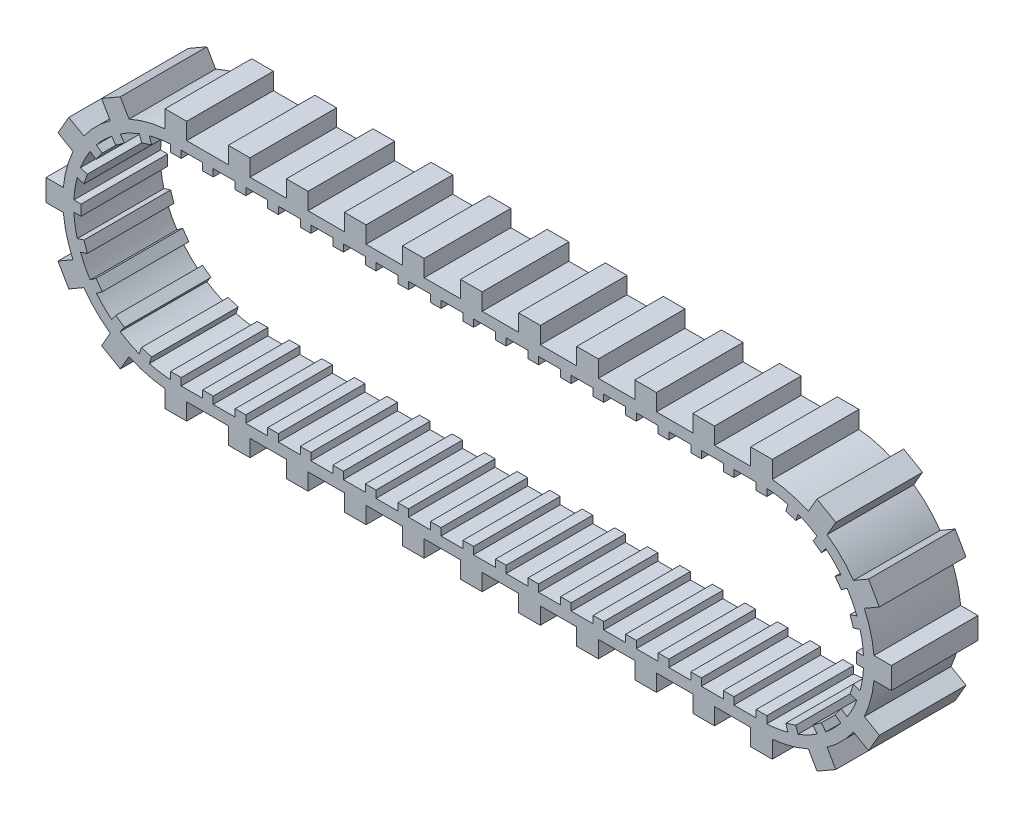
from build123d import *

# Parameters (mm, degrees)
BOSS_EXTRUDE1_DEPTH      = 25.4
BOSS_EXTRUDE2_DEPTH      = 25.4
CIRPATTERN1_COUNT        = 11
CIRPATTERN1_ANGLE        = 180
MIRROR2_COPY_1_DEPTH     = 25.4
MIRROR2_COPY_2_DEPTH     = 25.4
MIRROR2_COPY_3_DEPTH     = 25.4
MIRROR2_COPY_4_DEPTH     = 25.4
MIRROR2_COPY_5_DEPTH     = 25.4
MIRROR2_COPY_6_DEPTH     = 25.4
MIRROR2_COPY_7_DEPTH     = 25.4
MIRROR2_COPY_8_DEPTH     = 25.4
MIRROR2_COPY_9_DEPTH     = 25.4
MIRROR2_COPY_10_DEPTH    = 25.4
SKETCH5_W                = 3.10134
SKETCH5_H                = 2.1336
BOSS_EXTRUDE3_DEPTH      = 25.4
LPATTERN1_COUNT          = 17
LPATTERN1_PITCH          = 9.5377
MIRROR3_COPY_1_SKETCH_W  = 3.10134
MIRROR3_COPY_1_SKETCH_H  = 2.1336
MIRROR3_COPY_1_DEPTH     = 25.4
MIRROR3_COPY_2_SKETCH_W  = 3.10134
MIRROR3_COPY_2_SKETCH_H  = 2.1336
MIRROR3_COPY_2_DEPTH     = 25.4
MIRROR3_COPY_3_SKETCH_W  = 3.10134
MIRROR3_COPY_3_SKETCH_H  = 2.1336
MIRROR3_COPY_3_DEPTH     = 25.4
MIRROR3_COPY_4_SKETCH_W  = 3.10134
MIRROR3_COPY_4_SKETCH_H  = 2.1336
MIRROR3_COPY_4_DEPTH     = 25.4
MIRROR3_COPY_5_SKETCH_W  = 3.10134
MIRROR3_COPY_5_SKETCH_H  = 2.1336
MIRROR3_COPY_5_DEPTH     = 25.4
MIRROR3_COPY_6_SKETCH_W  = 3.10134
MIRROR3_COPY_6_SKETCH_H  = 2.1336
MIRROR3_COPY_6_DEPTH     = 25.4
MIRROR3_COPY_7_SKETCH_W  = 3.10134
MIRROR3_COPY_7_SKETCH_H  = 2.1336
MIRROR3_COPY_7_DEPTH     = 25.4
MIRROR3_COPY_8_SKETCH_W  = 3.10134
MIRROR3_COPY_8_SKETCH_H  = 2.1336
MIRROR3_COPY_8_DEPTH     = 25.4
MIRROR3_COPY_9_SKETCH_W  = 3.10134
MIRROR3_COPY_9_SKETCH_H  = 2.1336
MIRROR3_COPY_9_DEPTH     = 25.4
MIRROR3_COPY_10_SKETCH_W = 3.10134
MIRROR3_COPY_10_SKETCH_H = 2.1336
MIRROR3_COPY_10_DEPTH    = 25.4
MIRROR3_COPY_11_SKETCH_W = 3.10134
MIRROR3_COPY_11_SKETCH_H = 2.1336
MIRROR3_COPY_11_DEPTH    = 25.4
MIRROR3_COPY_12_SKETCH_W = 3.10134
MIRROR3_COPY_12_SKETCH_H = 2.1336
MIRROR3_COPY_12_DEPTH    = 25.4
MIRROR3_COPY_13_SKETCH_W = 3.10134
MIRROR3_COPY_13_SKETCH_H = 2.1336
MIRROR3_COPY_13_DEPTH    = 25.4
MIRROR3_COPY_14_SKETCH_W = 3.10134
MIRROR3_COPY_14_SKETCH_H = 2.1336
MIRROR3_COPY_14_DEPTH    = 25.4
MIRROR3_COPY_15_SKETCH_W = 3.10134
MIRROR3_COPY_15_SKETCH_H = 2.1336
MIRROR3_COPY_15_DEPTH    = 25.4
MIRROR3_COPY_16_SKETCH_W = 3.10134
MIRROR3_COPY_16_SKETCH_H = 2.1336
MIRROR3_COPY_16_DEPTH    = 25.4
SKETCH6_W                = 6.35
SKETCH6_H                = 5.08
BOSS_EXTRUDE4_DEPTH      = 25.4
CIRPATTERN2_COUNT        = 7
CIRPATTERN2_ANGLE        = 180
MIRROR4_COPY_1_SKETCH_W  = 6.35
MIRROR4_COPY_1_SKETCH_H  = 5.08
MIRROR4_COPY_1_DEPTH     = 25.4
MIRROR4_COPY_2_SKETCH_W  = 6.35
MIRROR4_COPY_2_SKETCH_H  = 5.08
MIRROR4_COPY_2_DEPTH     = 25.4
MIRROR4_COPY_3_SKETCH_W  = 6.35
MIRROR4_COPY_3_SKETCH_H  = 5.08
MIRROR4_COPY_3_DEPTH     = 25.4
MIRROR4_COPY_4_SKETCH_W  = 6.35
MIRROR4_COPY_4_SKETCH_H  = 5.08
MIRROR4_COPY_4_DEPTH     = 25.4
MIRROR4_COPY_5_SKETCH_W  = 6.35
MIRROR4_COPY_5_SKETCH_H  = 5.08
MIRROR4_COPY_5_DEPTH     = 25.4
MIRROR4_COPY_6_SKETCH_W  = 6.35
MIRROR4_COPY_6_SKETCH_H  = 5.08
MIRROR4_COPY_6_DEPTH     = 25.4
SKETCH10_W               = 6.35
SKETCH10_H               = 4.927531536
BOSS_EXTRUDE5_DEPTH      = 25.4
LPATTERN2_COUNT          = 9
LPATTERN2_PITCH          = 17.018
MIRROR5_COPY_1_SKETCH_W  = 6.35
MIRROR5_COPY_1_SKETCH_H  = 4.927531536
MIRROR5_COPY_1_DEPTH     = 25.4
MIRROR5_COPY_2_SKETCH_W  = 6.35
MIRROR5_COPY_2_SKETCH_H  = 4.927531536
MIRROR5_COPY_2_DEPTH     = 25.4
MIRROR5_COPY_3_SKETCH_W  = 6.35
MIRROR5_COPY_3_SKETCH_H  = 4.927531536
MIRROR5_COPY_3_DEPTH     = 25.4
MIRROR5_COPY_4_SKETCH_W  = 6.35
MIRROR5_COPY_4_SKETCH_H  = 4.927531536
MIRROR5_COPY_4_DEPTH     = 25.4
MIRROR5_COPY_5_SKETCH_W  = 6.35
MIRROR5_COPY_5_SKETCH_H  = 4.927531536
MIRROR5_COPY_5_DEPTH     = 25.4
MIRROR5_COPY_6_SKETCH_W  = 6.35
MIRROR5_COPY_6_SKETCH_H  = 4.927531536
MIRROR5_COPY_6_DEPTH     = 25.4
MIRROR5_COPY_7_SKETCH_W  = 6.35
MIRROR5_COPY_7_SKETCH_H  = 4.927531536
MIRROR5_COPY_7_DEPTH     = 25.4
MIRROR5_COPY_8_SKETCH_W  = 6.35
MIRROR5_COPY_8_SKETCH_H  = 4.927531536
MIRROR5_COPY_8_DEPTH     = 25.4


with BuildPart() as part:
    # Sketch1 → Boss-Extrude1 (new body)
    with BuildSketch(Plane.XY):
        with BuildLine():
            Line((0, 33.1343), (171.632290117, 33.1343))
            ThreePointArc((171.632290117, 33.1343), (204.766590117, 0), (171.632290117, -33.1343))
            Line((171.632290117, -33.1343), (0, -33.1343))
            ThreePointArc((0, -33.1343), (-33.1343, 0), (0, 33.1343))
        make_face()
        with BuildLine():
            Line((0, 29.9339), (171.632290117, 29.9339))
            ThreePointArc((171.632290117, 29.9339), (201.566190117, 0), (171.632290117, -29.9339))
            Line((171.632290117, -29.9339), (0, -29.9339))
            ThreePointArc((0, -29.9339), (-29.9339, 0), (0, 29.9339))
        make_face(mode=Mode.SUBTRACT)
    extrude(amount=-BOSS_EXTRUDE1_DEPTH)

    # Sketch3 → Boss-Extrude2 (add)
    with BuildSketch(Plane.XY):
        Polygon((-1.55067, 27.8003), (1.55067, 27.8003), (1.55067, 30.101580881), (-1.55067, 30.401027434), align=None)
    boss_extrude2 = extrude(amount=-BOSS_EXTRUDE2_DEPTH)

    # CirPattern1: Boss-Extrude2 ×11 about axis
    cirpattern1_axis = Axis((0, 0, 0), (0, 0, 1))
    for i in range(1, CIRPATTERN1_COUNT):
        add(boss_extrude2.rotate(cirpattern1_axis, i * CIRPATTERN1_ANGLE / (CIRPATTERN1_COUNT - 1)))

    # Mirror2: Boss-Extrude2 across plane
    add(boss_extrude2.mirror(Plane(origin=(85.816145059, 0, 0), x_dir=(0, 0, 1), z_dir=(1, 0, 0))))

    # Mirror2 copy 1 sketch → Mirror2 copy 1 (add)
    with BuildSketch(Plane(origin=(171.632290117, 0, 0), x_dir=(-0.9510565162951534, 0.30901699437494806, 0), z_dir=(0, 0, 1))):
        Polygon((-1.55067, -27.8003), (1.55067, -27.8003), (1.55067, -30.101580881), (-1.55067, -30.401027434), align=None)
    extrude(amount=-MIRROR2_COPY_1_DEPTH)

    # Mirror2 copy 2 sketch → Mirror2 copy 2 (add)
    with BuildSketch(Plane(origin=(171.632290117, 0, 0), x_dir=(-0.8090169943749467, 0.5877852522924741, 0), z_dir=(0, 0, 1))):
        Polygon((-1.55067, -27.8003), (1.55067, -27.8003), (1.55067, -30.101580881), (-1.55067, -30.401027434), align=None)
    extrude(amount=-MIRROR2_COPY_2_DEPTH)

    # Mirror2 copy 3 sketch → Mirror2 copy 3 (add)
    with BuildSketch(Plane(origin=(171.632290117, 0, 0), x_dir=(-0.5877852522924716, 0.8090169943749486, 0), z_dir=(0, 0, 1))):
        Polygon((-1.55067, -27.8003), (1.55067, -27.8003), (1.55067, -30.101580881), (-1.55067, -30.401027434), align=None)
    extrude(amount=-MIRROR2_COPY_3_DEPTH)

    # Mirror2 copy 4 sketch → Mirror2 copy 4 (add)
    with BuildSketch(Plane(origin=(171.632290117, 0, 0), x_dir=(-0.30901699437494495, 0.9510565162951544, 0), z_dir=(0, 0, 1))):
        Polygon((-1.55067, -27.8003), (1.55067, -27.8003), (1.55067, -30.101580881), (-1.55067, -30.401027434), align=None)
    extrude(amount=-MIRROR2_COPY_4_DEPTH)

    # Mirror2 copy 5 sketch → Mirror2 copy 5 (add)
    with BuildSketch(Plane(origin=(171.632290117, 0, 0), x_dir=(0, 1, 0), z_dir=(0, 0, 1))):
        Polygon((-1.55067, -27.8003), (1.55067, -27.8003), (1.55067, -30.101580881), (-1.55067, -30.401027434), align=None)
    extrude(amount=-MIRROR2_COPY_5_DEPTH)

    # Mirror2 copy 6 sketch → Mirror2 copy 6 (add)
    with BuildSketch(Plane(origin=(171.632290117, 0, 0), x_dir=(0.30901699437495117, 0.9510565162951523, 0), z_dir=(0, 0, 1))):
        Polygon((-1.55067, -27.8003), (1.55067, -27.8003), (1.55067, -30.101580881), (-1.55067, -30.401027434), align=None)
    extrude(amount=-MIRROR2_COPY_6_DEPTH)

    # Mirror2 copy 7 sketch → Mirror2 copy 7 (add)
    with BuildSketch(Plane(origin=(171.632290117, 0, 0), x_dir=(0.587785252292477, 0.8090169943749446, 0), z_dir=(0, 0, 1))):
        Polygon((-1.55067, -27.8003), (1.55067, -27.8003), (1.55067, -30.101580881), (-1.55067, -30.401027434), align=None)
    extrude(amount=-MIRROR2_COPY_7_DEPTH)

    # Mirror2 copy 8 sketch → Mirror2 copy 8 (add)
    with BuildSketch(Plane(origin=(171.632290117, 0, 0), x_dir=(0.8090169943749504, 0.5877852522924689, 0), z_dir=(0, 0, 1))):
        Polygon((-1.55067, -27.8003), (1.55067, -27.8003), (1.55067, -30.101580881), (-1.55067, -30.401027434), align=None)
    extrude(amount=-MIRROR2_COPY_8_DEPTH)

    # Mirror2 copy 9 sketch → Mirror2 copy 9 (add)
    with BuildSketch(Plane(origin=(171.632290117, 0, 0), x_dir=(0.9510565162951554, 0.3090169943749416, 0), z_dir=(0, 0, 1))):
        Polygon((-1.55067, -27.8003), (1.55067, -27.8003), (1.55067, -30.101580881), (-1.55067, -30.401027434), align=None)
    extrude(amount=-MIRROR2_COPY_9_DEPTH)

    # Mirror2 copy 10 sketch → Mirror2 copy 10 (add)
    with BuildSketch(Plane(origin=(171.632290117, 0, 0), x_dir=(1, 0, 0), z_dir=(0, 0, 1))):
        Polygon((-1.55067, -27.8003), (1.55067, -27.8003), (1.55067, -30.101580881), (-1.55067, -30.401027434), align=None)
    extrude(amount=-MIRROR2_COPY_10_DEPTH)

    # Sketch5 → Boss-Extrude3 (add)
    with BuildSketch(Plane.XY):
        with Locations((9.40054, 28.8671)):
            Rectangle(SKETCH5_W, SKETCH5_H)
    boss_extrude3 = extrude(amount=-BOSS_EXTRUDE3_DEPTH)

    # LPattern1: Boss-Extrude3 ×17
    with Locations(*[(i * LPATTERN1_PITCH, 0, 0) for i in range(1, LPATTERN1_COUNT)]):
        add(boss_extrude3)

    # Mirror3: Boss-Extrude3 across plane
    add(boss_extrude3.mirror(Plane.ZX))

    # Mirror3 copy 1 sketch → Mirror3 copy 1 (add)
    with BuildSketch(Plane(origin=(9.5377, 0, 0), x_dir=(1, 0, 0), z_dir=(0, 0, 1))):
        with Locations((9.40054, -28.8671)):
            Rectangle(MIRROR3_COPY_1_SKETCH_W, MIRROR3_COPY_1_SKETCH_H)
    extrude(amount=-MIRROR3_COPY_1_DEPTH)

    # Mirror3 copy 2 sketch → Mirror3 copy 2 (add)
    with BuildSketch(Plane(origin=(19.0754, 0, 0), x_dir=(1, 0, 0), z_dir=(0, 0, 1))):
        with Locations((9.40054, -28.8671)):
            Rectangle(MIRROR3_COPY_2_SKETCH_W, MIRROR3_COPY_2_SKETCH_H)
    extrude(amount=-MIRROR3_COPY_2_DEPTH)

    # Mirror3 copy 3 sketch → Mirror3 copy 3 (add)
    with BuildSketch(Plane(origin=(28.6131, 0, 0), x_dir=(1, 0, 0), z_dir=(0, 0, 1))):
        with Locations((9.40054, -28.8671)):
            Rectangle(MIRROR3_COPY_3_SKETCH_W, MIRROR3_COPY_3_SKETCH_H)
    extrude(amount=-MIRROR3_COPY_3_DEPTH)

    # Mirror3 copy 4 sketch → Mirror3 copy 4 (add)
    with BuildSketch(Plane(origin=(38.1508, 0, 0), x_dir=(1, 0, 0), z_dir=(0, 0, 1))):
        with Locations((9.40054, -28.8671)):
            Rectangle(MIRROR3_COPY_4_SKETCH_W, MIRROR3_COPY_4_SKETCH_H)
    extrude(amount=-MIRROR3_COPY_4_DEPTH)

    # Mirror3 copy 5 sketch → Mirror3 copy 5 (add)
    with BuildSketch(Plane(origin=(47.6885, 0, 0), x_dir=(1, 0, 0), z_dir=(0, 0, 1))):
        with Locations((9.40054, -28.8671)):
            Rectangle(MIRROR3_COPY_5_SKETCH_W, MIRROR3_COPY_5_SKETCH_H)
    extrude(amount=-MIRROR3_COPY_5_DEPTH)

    # Mirror3 copy 6 sketch → Mirror3 copy 6 (add)
    with BuildSketch(Plane(origin=(57.2262, 0, 0), x_dir=(1, 0, 0), z_dir=(0, 0, 1))):
        with Locations((9.40054, -28.8671)):
            Rectangle(MIRROR3_COPY_6_SKETCH_W, MIRROR3_COPY_6_SKETCH_H)
    extrude(amount=-MIRROR3_COPY_6_DEPTH)

    # Mirror3 copy 7 sketch → Mirror3 copy 7 (add)
    with BuildSketch(Plane(origin=(66.7639, 0, 0), x_dir=(1, 0, 0), z_dir=(0, 0, 1))):
        with Locations((9.40054, -28.8671)):
            Rectangle(MIRROR3_COPY_7_SKETCH_W, MIRROR3_COPY_7_SKETCH_H)
    extrude(amount=-MIRROR3_COPY_7_DEPTH)

    # Mirror3 copy 8 sketch → Mirror3 copy 8 (add)
    with BuildSketch(Plane(origin=(76.3016, 0, 0), x_dir=(1, 0, 0), z_dir=(0, 0, 1))):
        with Locations((9.40054, -28.8671)):
            Rectangle(MIRROR3_COPY_8_SKETCH_W, MIRROR3_COPY_8_SKETCH_H)
    extrude(amount=-MIRROR3_COPY_8_DEPTH)

    # Mirror3 copy 9 sketch → Mirror3 copy 9 (add)
    with BuildSketch(Plane(origin=(85.8393, 0, 0), x_dir=(1, 0, 0), z_dir=(0, 0, 1))):
        with Locations((9.40054, -28.8671)):
            Rectangle(MIRROR3_COPY_9_SKETCH_W, MIRROR3_COPY_9_SKETCH_H)
    extrude(amount=-MIRROR3_COPY_9_DEPTH)

    # Mirror3 copy 10 sketch → Mirror3 copy 10 (add)
    with BuildSketch(Plane(origin=(95.377, 0, 0), x_dir=(1, 0, 0), z_dir=(0, 0, 1))):
        with Locations((9.40054, -28.8671)):
            Rectangle(MIRROR3_COPY_10_SKETCH_W, MIRROR3_COPY_10_SKETCH_H)
    extrude(amount=-MIRROR3_COPY_10_DEPTH)

    # Mirror3 copy 11 sketch → Mirror3 copy 11 (add)
    with BuildSketch(Plane(origin=(104.9147, 0, 0), x_dir=(1, 0, 0), z_dir=(0, 0, 1))):
        with Locations((9.40054, -28.8671)):
            Rectangle(MIRROR3_COPY_11_SKETCH_W, MIRROR3_COPY_11_SKETCH_H)
    extrude(amount=-MIRROR3_COPY_11_DEPTH)

    # Mirror3 copy 12 sketch → Mirror3 copy 12 (add)
    with BuildSketch(Plane(origin=(114.4524, 0, 0), x_dir=(1, 0, 0), z_dir=(0, 0, 1))):
        with Locations((9.40054, -28.8671)):
            Rectangle(MIRROR3_COPY_12_SKETCH_W, MIRROR3_COPY_12_SKETCH_H)
    extrude(amount=-MIRROR3_COPY_12_DEPTH)

    # Mirror3 copy 13 sketch → Mirror3 copy 13 (add)
    with BuildSketch(Plane(origin=(123.9901, 0, 0), x_dir=(1, 0, 0), z_dir=(0, 0, 1))):
        with Locations((9.40054, -28.8671)):
            Rectangle(MIRROR3_COPY_13_SKETCH_W, MIRROR3_COPY_13_SKETCH_H)
    extrude(amount=-MIRROR3_COPY_13_DEPTH)

    # Mirror3 copy 14 sketch → Mirror3 copy 14 (add)
    with BuildSketch(Plane(origin=(133.5278, 0, 0), x_dir=(1, 0, 0), z_dir=(0, 0, 1))):
        with Locations((9.40054, -28.8671)):
            Rectangle(MIRROR3_COPY_14_SKETCH_W, MIRROR3_COPY_14_SKETCH_H)
    extrude(amount=-MIRROR3_COPY_14_DEPTH)

    # Mirror3 copy 15 sketch → Mirror3 copy 15 (add)
    with BuildSketch(Plane(origin=(143.0655, 0, 0), x_dir=(1, 0, 0), z_dir=(0, 0, 1))):
        with Locations((9.40054, -28.8671)):
            Rectangle(MIRROR3_COPY_15_SKETCH_W, MIRROR3_COPY_15_SKETCH_H)
    extrude(amount=-MIRROR3_COPY_15_DEPTH)

    # Mirror3 copy 16 sketch → Mirror3 copy 16 (add)
    with BuildSketch(Plane(origin=(152.6032, 0, 0), x_dir=(1, 0, 0), z_dir=(0, 0, 1))):
        with Locations((9.40054, -28.8671)):
            Rectangle(MIRROR3_COPY_16_SKETCH_W, MIRROR3_COPY_16_SKETCH_H)
    extrude(amount=-MIRROR3_COPY_16_DEPTH)

    # Sketch6 → Boss-Extrude4 (add)
    with BuildSketch(Plane.XY):
        with Locations((0, 35.521831536)):
            Rectangle(SKETCH6_W, SKETCH6_H)
    boss_extrude4 = extrude(amount=-BOSS_EXTRUDE4_DEPTH)

    # CirPattern2: Boss-Extrude4 ×7 about axis
    cirpattern2_axis = Axis((0, 0, 0), (0, 0, 1))
    for i in range(1, CIRPATTERN2_COUNT):
        add(boss_extrude4.rotate(cirpattern2_axis, i * CIRPATTERN2_ANGLE / (CIRPATTERN2_COUNT - 1)))

    # Mirror4: Boss-Extrude4 across plane
    add(boss_extrude4.mirror(Plane(origin=(85.816145059, 0, 0), x_dir=(0, 0, 1), z_dir=(1, 0, 0))))

    # Mirror4 copy 1 sketch → Mirror4 copy 1 (add)
    with BuildSketch(Plane(origin=(171.632290117, 0, 0), x_dir=(-0.866025403784438, 0.500000000000001, 0), z_dir=(0, 0, 1))):
        with Locations((0, -35.521831536)):
            Rectangle(MIRROR4_COPY_1_SKETCH_W, MIRROR4_COPY_1_SKETCH_H)
    extrude(amount=-MIRROR4_COPY_1_DEPTH)

    # Mirror4 copy 2 sketch → Mirror4 copy 2 (add)
    with BuildSketch(Plane(origin=(171.632290117, 0, 0), x_dir=(-0.499999999999998, 0.8660254037844398, 0), z_dir=(0, 0, 1))):
        with Locations((0, -35.521831536)):
            Rectangle(MIRROR4_COPY_2_SKETCH_W, MIRROR4_COPY_2_SKETCH_H)
    extrude(amount=-MIRROR4_COPY_2_DEPTH)

    # Mirror4 copy 3 sketch → Mirror4 copy 3 (add)
    with BuildSketch(Plane(origin=(171.632290117, 0, 0), x_dir=(0, 1, 0), z_dir=(0, 0, 1))):
        with Locations((0, -35.521831536)):
            Rectangle(MIRROR4_COPY_3_SKETCH_W, MIRROR4_COPY_3_SKETCH_H)
    extrude(amount=-MIRROR4_COPY_3_DEPTH)

    # Mirror4 copy 4 sketch → Mirror4 copy 4 (add)
    with BuildSketch(Plane(origin=(171.632290117, 0, 0), x_dir=(0.500000000000004, 0.8660254037844363, 0), z_dir=(0, 0, 1))):
        with Locations((0, -35.521831536)):
            Rectangle(MIRROR4_COPY_4_SKETCH_W, MIRROR4_COPY_4_SKETCH_H)
    extrude(amount=-MIRROR4_COPY_4_DEPTH)

    # Mirror4 copy 5 sketch → Mirror4 copy 5 (add)
    with BuildSketch(Plane(origin=(171.632290117, 0, 0), x_dir=(0.8660254037844416, 0.49999999999999495, 0), z_dir=(0, 0, 1))):
        with Locations((0, -35.521831536)):
            Rectangle(MIRROR4_COPY_5_SKETCH_W, MIRROR4_COPY_5_SKETCH_H)
    extrude(amount=-MIRROR4_COPY_5_DEPTH)

    # Mirror4 copy 6 sketch → Mirror4 copy 6 (add)
    with BuildSketch(Plane(origin=(171.632290117, 0, 0), x_dir=(1, 0, 0), z_dir=(0, 0, 1))):
        with Locations((0, -35.521831536)):
            Rectangle(MIRROR4_COPY_6_SKETCH_W, MIRROR4_COPY_6_SKETCH_H)
    extrude(amount=-MIRROR4_COPY_6_DEPTH)

    # Sketch10 → Boss-Extrude5 (add)
    with BuildSketch(Plane.XY):
        with Locations((18.542, 35.598065768)):
            Rectangle(SKETCH10_W, SKETCH10_H)
    boss_extrude5 = extrude(amount=-BOSS_EXTRUDE5_DEPTH)

    # LPattern2: Boss-Extrude5 ×9
    with Locations(*[(i * LPATTERN2_PITCH, 0, 0) for i in range(1, LPATTERN2_COUNT)]):
        add(boss_extrude5)

    # Mirror5: Boss-Extrude5 across plane
    add(boss_extrude5.mirror(Plane.ZX))

    # Mirror5 copy 1 sketch → Mirror5 copy 1 (add)
    with BuildSketch(Plane(origin=(17.018, 0, 0), x_dir=(1, 0, 0), z_dir=(0, 0, 1))):
        with Locations((18.542, -35.598065768)):
            Rectangle(MIRROR5_COPY_1_SKETCH_W, MIRROR5_COPY_1_SKETCH_H)
    extrude(amount=-MIRROR5_COPY_1_DEPTH)

    # Mirror5 copy 2 sketch → Mirror5 copy 2 (add)
    with BuildSketch(Plane(origin=(34.036, 0, 0), x_dir=(1, 0, 0), z_dir=(0, 0, 1))):
        with Locations((18.542, -35.598065768)):
            Rectangle(MIRROR5_COPY_2_SKETCH_W, MIRROR5_COPY_2_SKETCH_H)
    extrude(amount=-MIRROR5_COPY_2_DEPTH)

    # Mirror5 copy 3 sketch → Mirror5 copy 3 (add)
    with BuildSketch(Plane(origin=(51.054, 0, 0), x_dir=(1, 0, 0), z_dir=(0, 0, 1))):
        with Locations((18.542, -35.598065768)):
            Rectangle(MIRROR5_COPY_3_SKETCH_W, MIRROR5_COPY_3_SKETCH_H)
    extrude(amount=-MIRROR5_COPY_3_DEPTH)

    # Mirror5 copy 4 sketch → Mirror5 copy 4 (add)
    with BuildSketch(Plane(origin=(68.072, 0, 0), x_dir=(1, 0, 0), z_dir=(0, 0, 1))):
        with Locations((18.542, -35.598065768)):
            Rectangle(MIRROR5_COPY_4_SKETCH_W, MIRROR5_COPY_4_SKETCH_H)
    extrude(amount=-MIRROR5_COPY_4_DEPTH)

    # Mirror5 copy 5 sketch → Mirror5 copy 5 (add)
    with BuildSketch(Plane(origin=(85.09, 0, 0), x_dir=(1, 0, 0), z_dir=(0, 0, 1))):
        with Locations((18.542, -35.598065768)):
            Rectangle(MIRROR5_COPY_5_SKETCH_W, MIRROR5_COPY_5_SKETCH_H)
    extrude(amount=-MIRROR5_COPY_5_DEPTH)

    # Mirror5 copy 6 sketch → Mirror5 copy 6 (add)
    with BuildSketch(Plane(origin=(102.108, 0, 0), x_dir=(1, 0, 0), z_dir=(0, 0, 1))):
        with Locations((18.542, -35.598065768)):
            Rectangle(MIRROR5_COPY_6_SKETCH_W, MIRROR5_COPY_6_SKETCH_H)
    extrude(amount=-MIRROR5_COPY_6_DEPTH)

    # Mirror5 copy 7 sketch → Mirror5 copy 7 (add)
    with BuildSketch(Plane(origin=(119.126, 0, 0), x_dir=(1, 0, 0), z_dir=(0, 0, 1))):
        with Locations((18.542, -35.598065768)):
            Rectangle(MIRROR5_COPY_7_SKETCH_W, MIRROR5_COPY_7_SKETCH_H)
    extrude(amount=-MIRROR5_COPY_7_DEPTH)

    # Mirror5 copy 8 sketch → Mirror5 copy 8 (add)
    with BuildSketch(Plane(origin=(136.144, 0, 0), x_dir=(1, 0, 0), z_dir=(0, 0, 1))):
        with Locations((18.542, -35.598065768)):
            Rectangle(MIRROR5_COPY_8_SKETCH_W, MIRROR5_COPY_8_SKETCH_H)
    extrude(amount=-MIRROR5_COPY_8_DEPTH)


solid = part.part
